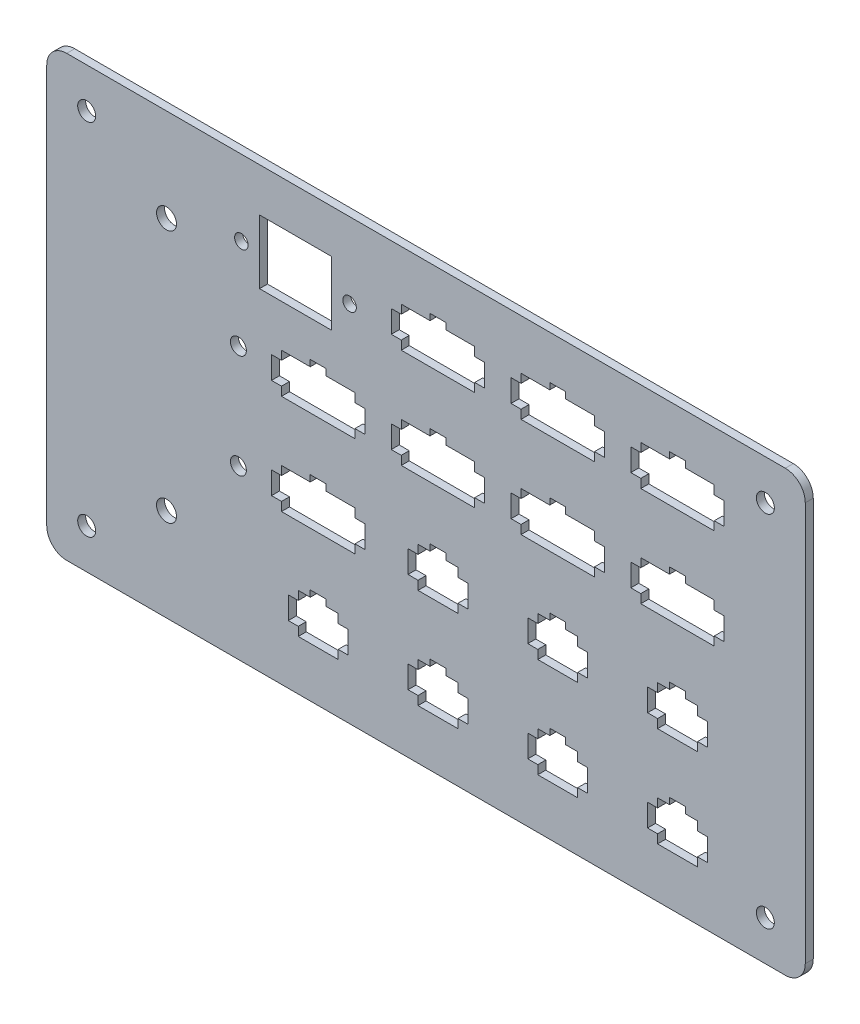
from build123d import *

# Parameters (mm, degrees)
SKETCH1_W             = 180
SKETCH1_H             = 100
BOSS_EXTRUDE1_DEPTH   = 2
CUT_EXTRUDE1_REACH    = 104.976
LPATTERN1_COUNT       = 3
LPATTERN1_PITCH       = 30
LPATTERN1_COUNT_DIR2  = 2
LPATTERN1_PITCH_DIR2  = 25
CUT_EXTRUDE6_REACH    = 104.976
LPATTERN2_COUNT       = 3
LPATTERN2_PITCH       = 30
LPATTERN2_COUNT_DIR2  = 2
LPATTERN2_PITCH_DIR2  = 25
M4_CLEARANCE_HOLE1_D  = 4.5
SKETCH8_R             = 2.5
SKETCH8_R_2           = 2
CUT_EXTRUDE8_DEPTH    = 10
CUT_EXTRUDE7_REACH    = 104.976
SKETCH5_R             = 1.7
SKETCH5_W             = 18
SKETCH5_H             = 16
SKETCH13_W            = 190
SKETCH13_H            = 110
SKETCH13_W_2          = 180
SKETCH13_H_2          = 100
BOSS_EXTRUDE2_DEPTH   = 2
LPATTERN3_START       = -42.5
LPATTERN3_OUTLINE_W   = 10
LPATTERN3_OUTLINE_H   = 2
LPATTERN3_DEPTH       = 10
LPATTERN3_START_2     = -17.5
LPATTERN3_2_OUTLINE_W = 10
LPATTERN3_2_OUTLINE_H = 2
LPATTERN3_2_DEPTH     = 10
LPATTERN3_START_3     = -40.3
LPATTERN3_3_OUTLINE_W = 2.5
LPATTERN3_3_OUTLINE_H = 2
LPATTERN3_3_DEPTH     = 5.6
LPATTERN3_START_4     = -15.3
LPATTERN3_4_OUTLINE_W = 2.5
LPATTERN3_4_OUTLINE_H = 2
LPATTERN3_4_DEPTH     = 5.6
LPATTERN3_START_5     = -32.5
LPATTERN3_5_OUTLINE_W = 4
LPATTERN3_5_OUTLINE_H = 2
LPATTERN3_5_DEPTH     = 1.6
LPATTERN3_START_6     = -7.5
LPATTERN3_6_OUTLINE_W = 4
LPATTERN3_6_OUTLINE_H = 2
LPATTERN3_6_DEPTH     = 1.6
CUT_EXTRUDE9_DEPTH    = 2
CUT_EXTRUDE10_DEPTH   = 2
SKETCH14_R            = 2.5
SKETCH14_R_2          = 2
CUT_EXTRUDE13_DEPTH   = 2
SKETCH20_R            = 2.5
SKETCH20_R_2          = 2
BOSS_EXTRUDE4_DEPTH   = 2
FILLET1_R             = 5


# Read off the part's stored shape, not the designer's step: LPattern3
with BuildPart() as part:
    # Sketch1 → Boss-Extrude1 (new body)
    with BuildSketch(Plane.XY):
        Rectangle(SKETCH1_W, SKETCH1_H)
    extrude(amount=BOSS_EXTRUDE1_DEPTH)

    # Sketch2 → Cut-Extrude1 (cut, up to next)
    with BuildSketch(Plane.XY.offset(2), mode=Mode.PRIVATE) as cut_extrude1_sk1:
        Polygon((51.3, 40.3), (53.8, 40.3), (53.8, 42.5), (61, 42.5), (61, 44.1), (65, 44.1), (65, 42.5), (72.2, 42.5), (72.2, 40.3), (74.7, 40.3), (74.7, 34.7), (72.2, 34.7), (72.2, 32.5), (53.8, 32.5), (53.8, 34.7), (51.3, 34.7), align=None)
    cut_extrude1_tool1 = extrude(cut_extrude1_sk1.sketch, amount=-CUT_EXTRUDE1_REACH, mode=Mode.PRIVATE) & part.part
    cut_extrude1 = cut_extrude1_tool1.solids().sort_by_distance((63, 37.669963, 2))[0]
    add(cut_extrude1, mode=Mode.SUBTRACT)

    # LPattern1: Cut-Extrude1 3 × 2
    with Locations(*[(-i * LPATTERN1_PITCH, -j * LPATTERN1_PITCH_DIR2, 0) for i in range(LPATTERN1_COUNT) for j in range(LPATTERN1_COUNT_DIR2) if (i, j) != (0, 0)]):
        add(cut_extrude1, mode=Mode.SUBTRACT)

    # Sketch4 → Cut-Extrude6 (cut, up to next)
    with BuildSketch(Plane.XY.offset(2), mode=Mode.PRIVATE) as cut_extrude6_sk1:
        Polygon((55.5, -9.7), (58, -9.7), (58, -7.5), (61, -7.5), (61, -5.9), (65, -5.9), (65, -7.5), (68, -7.5), (68, -9.7), (70.5, -9.7), (70.5, -15.3), (68, -15.3), (68, -17.5), (58, -17.5), (58, -15.3), (55.5, -15.3), align=None)
    cut_extrude6_tool1 = extrude(cut_extrude6_sk1.sketch, amount=-CUT_EXTRUDE6_REACH, mode=Mode.PRIVATE) & part.part
    cut_extrude6 = cut_extrude6_tool1.solids().sort_by_distance((63, -12.22381, 2))[0]
    add(cut_extrude6, mode=Mode.SUBTRACT)

    # LPattern2: Cut-Extrude6 3 × 2
    with Locations(*[(-i * LPATTERN2_PITCH, -j * LPATTERN2_PITCH_DIR2, 0) for i in range(LPATTERN2_COUNT) for j in range(LPATTERN2_COUNT_DIR2) if (i, j) != (0, 0)]):
        add(cut_extrude6, mode=Mode.SUBTRACT)

    # M4 Clearance Hole1 (through all)
    with Locations(Plane.XY.offset(2)):
        with Locations((-85, 45), (85, 45), (85, -45), (-85, -45)):
            Hole(M4_CLEARANCE_HOLE1_D / 2)

    # Sketch8 → Cut-Extrude8 (cut)
    with BuildSketch(Plane.XY.offset(2)):
        with Locations((-83.5, -25)):
            Circle(SKETCH8_R)
        with Locations((-20.1, -25)):
            Circle(SKETCH8_R)
        with Locations((-64.8, 1)):
            Circle(SKETCH8_R_2)
        with Locations((-38.8, 1)):
            Circle(SKETCH8_R_2)
    extrude(amount=-CUT_EXTRUDE8_DEPTH, mode=Mode.SUBTRACT)

    # Sketch5 → Cut-Extrude7 (cut, up to next)
    with BuildSketch(Plane.XY.offset(2), mode=Mode.PRIVATE) as cut_extrude7_sk1:
        with Locations((-46.25, 36.1)):
            Circle(SKETCH5_R)
    cut_extrude7_tool1 = extrude(cut_extrude7_sk1.sketch, amount=-CUT_EXTRUDE7_REACH, mode=Mode.PRIVATE) & part.part
    # Sketch5 → Cut-Extrude7 (cut, up to next)
    with BuildSketch(Plane.XY.offset(2), mode=Mode.PRIVATE) as cut_extrude7_sk2:
        with Locations((-19.15, 36.1)):
            Circle(SKETCH5_R)
    cut_extrude7_tool2 = extrude(cut_extrude7_sk2.sketch, amount=-CUT_EXTRUDE7_REACH, mode=Mode.PRIVATE) & part.part
    # Sketch5 → Cut-Extrude7 (cut, up to next)
    with BuildSketch(Plane.XY.offset(2), mode=Mode.PRIVATE) as cut_extrude7_sk3:
        with Locations((-32.7, 36.1)):
            Rectangle(SKETCH5_W, SKETCH5_H)
    cut_extrude7_tool3 = extrude(cut_extrude7_sk3.sketch, amount=-CUT_EXTRUDE7_REACH, mode=Mode.PRIVATE) & part.part
    add(cut_extrude7_tool1.solids().sort_by_distance((-46.25, 36.1, 2))[0], mode=Mode.SUBTRACT)
    add(cut_extrude7_tool2.solids().sort_by_distance((-19.15, 36.1, 2))[0], mode=Mode.SUBTRACT)
    add(cut_extrude7_tool3.solids().sort_by_distance((-32.7, 36.1, 2))[0], mode=Mode.SUBTRACT)

    # Sketch13 → Boss-Extrude2 (add)
    with BuildSketch(Plane.XY):
        Rectangle(SKETCH13_W, SKETCH13_H)
        Rectangle(SKETCH13_W_2, SKETCH13_H_2, mode=Mode.SUBTRACT)
    extrude(amount=BOSS_EXTRUDE2_DEPTH)

    # LPattern3 outline → LPattern3 (cut)
    with BuildSketch(Plane(origin=(0, 0, 0), x_dir=(1, 0, 0), z_dir=(0, 1, 0)).offset(LPATTERN3_START)):
        with Locations((-27, -1)):
            Rectangle(LPATTERN3_OUTLINE_W, LPATTERN3_OUTLINE_H)
    extrude(amount=LPATTERN3_DEPTH, mode=Mode.SUBTRACT)

    # LPattern3 2 outline → LPattern3 2 (cut)
    with BuildSketch(Plane(origin=(0, 0, 0), x_dir=(1, 0, 0), z_dir=(0, 1, 0)).offset(LPATTERN3_START_2)):
        with Locations((-27, -1)):
            Rectangle(LPATTERN3_2_OUTLINE_W, LPATTERN3_2_OUTLINE_H)
    extrude(amount=LPATTERN3_2_DEPTH, mode=Mode.SUBTRACT)

    # LPattern3 3 outline → LPattern3 3 (cut)
    with BuildSketch(Plane(origin=(0, 0, 0), x_dir=(1, 0, 0), z_dir=(0, 1, 0)).offset(LPATTERN3_START_3)):
        with Locations((-33.25, -1)):
            Rectangle(LPATTERN3_3_OUTLINE_W, LPATTERN3_3_OUTLINE_H)
        with Locations((-20.75, -1)):
            Rectangle(LPATTERN3_3_OUTLINE_W, LPATTERN3_3_OUTLINE_H)
    extrude(amount=LPATTERN3_3_DEPTH, mode=Mode.SUBTRACT)

    # LPattern3 4 outline → LPattern3 4 (cut)
    with BuildSketch(Plane(origin=(0, 0, 0), x_dir=(1, 0, 0), z_dir=(0, 1, 0)).offset(LPATTERN3_START_4)):
        with Locations((-33.25, -1)):
            Rectangle(LPATTERN3_4_OUTLINE_W, LPATTERN3_4_OUTLINE_H)
        with Locations((-20.75, -1)):
            Rectangle(LPATTERN3_4_OUTLINE_W, LPATTERN3_4_OUTLINE_H)
    extrude(amount=LPATTERN3_4_DEPTH, mode=Mode.SUBTRACT)

    # LPattern3 5 outline → LPattern3 5 (cut)
    with BuildSketch(Plane(origin=(0, 0, 0), x_dir=(1, 0, 0), z_dir=(0, 1, 0)).offset(LPATTERN3_START_5)):
        with Locations((-27, -1)):
            Rectangle(LPATTERN3_5_OUTLINE_W, LPATTERN3_5_OUTLINE_H)
    extrude(amount=LPATTERN3_5_DEPTH, mode=Mode.SUBTRACT)

    # LPattern3 6 outline → LPattern3 6 (cut)
    with BuildSketch(Plane(origin=(0, 0, 0), x_dir=(1, 0, 0), z_dir=(0, 1, 0)).offset(LPATTERN3_START_6)):
        with Locations((-27, -1)):
            Rectangle(LPATTERN3_6_OUTLINE_W, LPATTERN3_6_OUTLINE_H)
    extrude(amount=LPATTERN3_6_DEPTH, mode=Mode.SUBTRACT)

    # Sketch16 → Cut-Extrude9 (cut)
    with BuildSketch(Plane.XY.offset(2)):
        Polygon((-36.2, -15.3), (-36.2, -17.5), (-17.8, -17.5), (-17.8, -15.3), (-15.3, -15.3), (-15.3, -9.7), (-17.8, -9.7), (-17.8, -7.5), (-25, -7.5), (-25, -5.9), (-29, -5.9), (-29, -7.5), (-36.2, -7.5), (-36.2, -9.7), (-38.7, -9.7), (-38.7, -15.3), align=None)
    extrude(amount=-CUT_EXTRUDE9_DEPTH, mode=Mode.SUBTRACT)

    # Sketch19 → Cut-Extrude10 (cut)
    with BuildSketch(Plane.XY.offset(2)):
        Polygon((-36.2, 9.7), (-36.2, 7.5), (-17.8, 7.5), (-17.8, 9.7), (-15.3, 9.7), (-15.3, 15.3), (-17.8, 15.3), (-17.8, 17.5), (-25, 17.5), (-25, 19.1), (-29, 19.1), (-29, 17.5), (-36.2, 17.5), (-36.2, 15.3), (-38.7, 15.3), (-38.7, 9.7), align=None)
    extrude(amount=-CUT_EXTRUDE10_DEPTH, mode=Mode.SUBTRACT)

    # Sketch14 → Cut-Extrude13 (cut)
    with BuildSketch(Plane.XY):
        with Locations((-65, 31.7)):
            Circle(SKETCH14_R)
        with Locations((-65, -31.7)):
            Circle(SKETCH14_R)
        with Locations((-47, 13)):
            Circle(SKETCH14_R_2)
        with Locations((-47, -13)):
            Circle(SKETCH14_R_2)
    extrude(amount=CUT_EXTRUDE13_DEPTH, mode=Mode.SUBTRACT)

    # Sketch20 → Boss-Extrude4 (add)
    with BuildSketch(Plane.XY.offset(2)):
        with Locations((-20.1, -25)):
            Circle(SKETCH20_R)
        with Locations((-38.8, 1)):
            Circle(SKETCH20_R_2)
        with Locations((-64.8, 1)):
            Circle(SKETCH20_R_2)
        with Locations((-83.5, -25)):
            Circle(SKETCH20_R)
    extrude(amount=-BOSS_EXTRUDE4_DEPTH)

    # Fillet1
    fillet1_edges = [part.edges().sort_by_distance(p)[0] for p in [
        (95, 55, 1),
        (95, -55, 1),
        (-95, -55, 1),
        (-95, 55, 1),
    ]]
    fillet(fillet1_edges, radius=FILLET1_R)


solid = part.part
